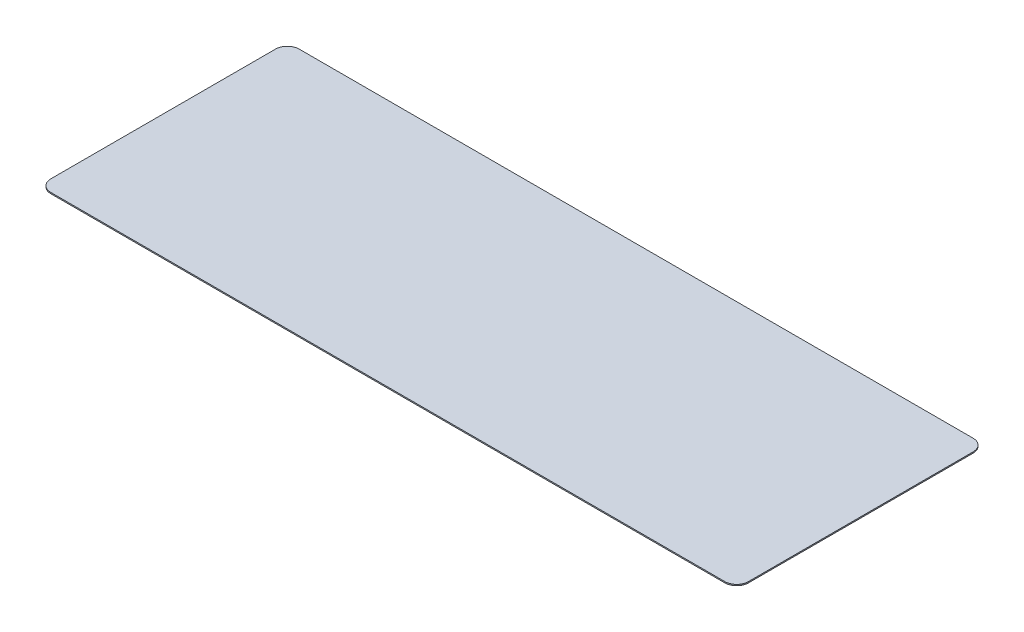
from build123d import *

# Parameters (mm, degrees)
SKETCH1_W           = 590
SKETCH1_H           = 210
BOSS_EXTRUDE1_DEPTH = 1
FILLET1_R           = 10


with BuildPart() as part:
    # Sketch1 → Boss-Extrude1 (new body)
    with BuildSketch(Plane(origin=(0, 0, 0), x_dir=(1, 0, 0), z_dir=(0, 1, 0))):
        Rectangle(SKETCH1_W, SKETCH1_H)
    extrude(amount=BOSS_EXTRUDE1_DEPTH)

    # Fillet1
    fillet1_edges = [part.edges().sort_by_distance(p)[0] for p in [
        (-295, 0.5, 105),
        (295, 0.5, 105),
        (295, 0.5, -105),
        (-295, 0.5, -105),
    ]]
    fillet(fillet1_edges, radius=FILLET1_R)


solid = part.part
